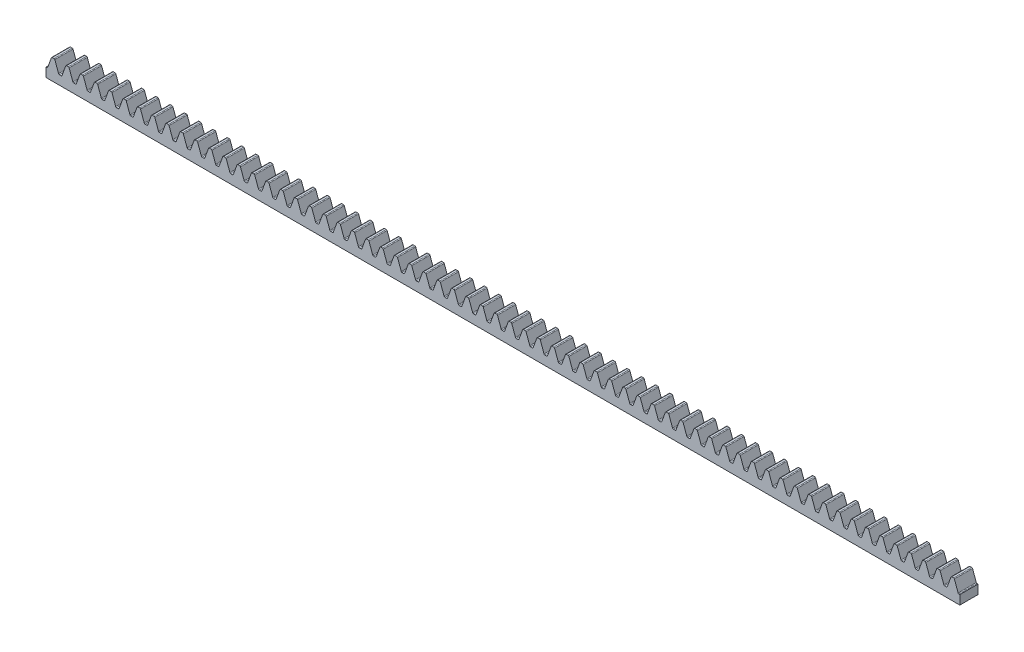
from build123d import *

# Parameters (mm, degrees)
BOSS_EXTRUDE1_DEPTH = 10
LPATTERN2_COUNT     = 64
LPATTERN2_PITCH     = 7.85398


with BuildPart() as part:
    # Sketch1 → Boss-Extrude1 (new body)
    with BuildSketch(Plane.XY):
        with BuildLine():
            Line((-3.926990817, 0), (3.926990817, 0))
            Line((3.926990817, 0), (3.926990817, 5))
            Line((3.926990817, 5), (3.45100616, 5))
            ThreePointArc((3.45100616, 5), (3.164217942, 5.090423978), (2.981159849, 5.328989928))
            Line((2.981159849, 5.328989928), (0.945830968, 10.921010072))
            ThreePointArc((0.945830968, 10.921010072), (0.762772875, 11.159576022), (0.475984657, 11.25))
            Line((0.475984657, 11.25), (-0.475984657, 11.25))
            ThreePointArc((-0.475984657, 11.25), (-0.762772875, 11.159576022), (-0.945830968, 10.921010072))
            Line((-0.945830968, 10.921010072), (-2.981159849, 5.328989928))
            ThreePointArc((-2.981159849, 5.328989928), (-3.164217942, 5.090423978), (-3.45100616, 5))
            Line((-3.45100616, 5), (-3.926990817, 5))
            Line((-3.926990817, 5), (-3.926990817, 0))
        make_face()
    boss_extrude1 = extrude(amount=BOSS_EXTRUDE1_DEPTH)

    # LPattern2: Boss-Extrude1 ×64
    with Locations(*[(-i * LPATTERN2_PITCH, 0, 0) for i in range(1, LPATTERN2_COUNT)]):
        add(boss_extrude1)


solid = part.part
